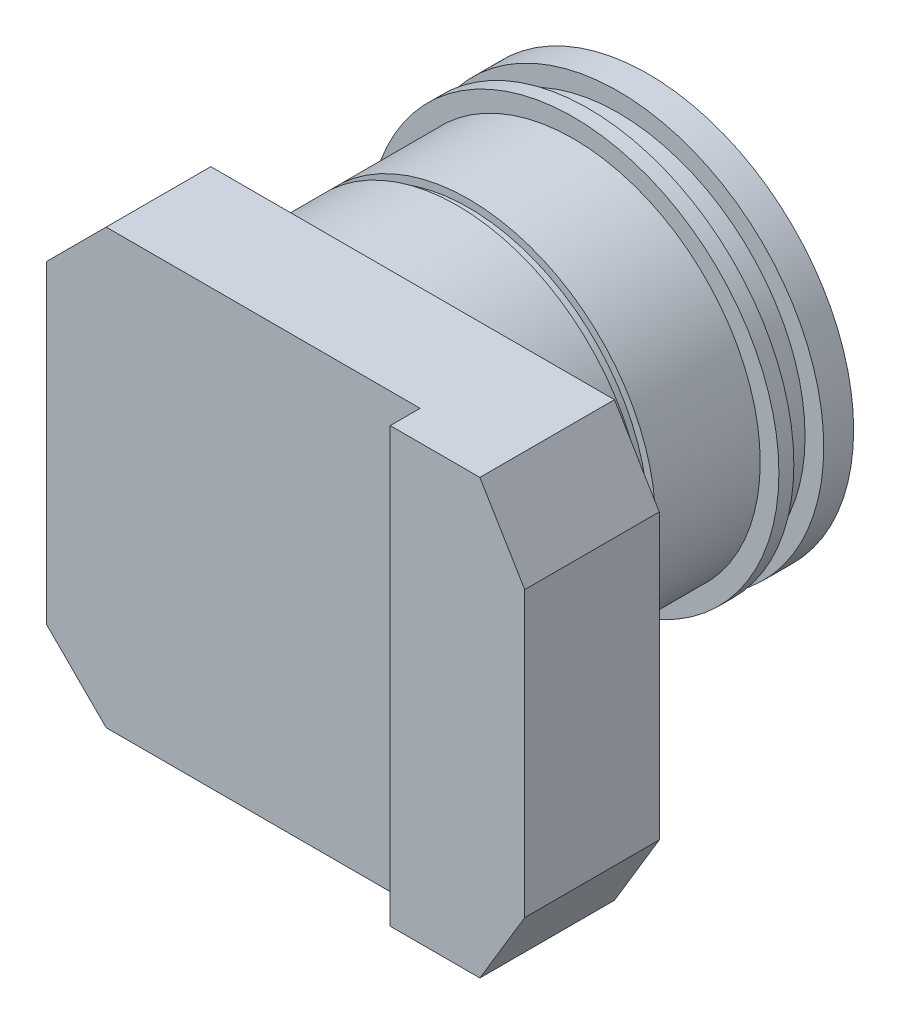
from build123d import *

# Parameters (mm, degrees)
SKETCH1_W           = 34
SKETCH1_H           = 29
BOSS_EXTRUDE1_DEPTH = 3.5
SKETCH2_W           = 9
SKETCH2_H           = 29
BOSS_EXTRUDE2_DEPTH = 2
CUT_EXTRUDE1_DEPTH  = 25.088378941
SKETCH5_R           = 9.75
CUT_EXTRUDE2_DEPTH  = 5
CUT_EXTRUDE2_DRAFT  = -45


with BuildPart() as part:
    # Sketch1 → Boss-Extrude1 (new, symmetric)
    with BuildSketch(Plane.XY):
        Rectangle(SKETCH1_W, SKETCH1_H)
    extrude(amount=BOSS_EXTRUDE1_DEPTH, both=True)

    # Sketch2 → Boss-Extrude2 (add)
    with BuildSketch(Plane.XY.offset(3.5)):
        with Locations((12.5, 0)):
            Rectangle(SKETCH2_W, SKETCH2_H)
    extrude(amount=BOSS_EXTRUDE2_DEPTH)

    # Sketch3 → Cut-Extrude1 (cut, through all)
    with BuildSketch(Plane(origin=(0, 0, -3.5), x_dir=(-1, 0, 0), z_dir=(0, 0, -1))):
        Polygon((-14, -14.5), (-17, -9.5), (-17, -14.5), align=None)
        Polygon((13, -14.5), (17, -10.5), (17, -14.5), align=None)
        Polygon((17, 10.5), (13, 14.5), (17, 14.5), align=None)
        Polygon((-17, 9.5), (-14, 14.5), (-17, 14.5), align=None)
    extrude(amount=-CUT_EXTRUDE1_DEPTH, mode=Mode.SUBTRACT)

    # Sketch4 → Revolve1 (revolve)
    with BuildSketch(Plane(origin=(0, 0, 0), x_dir=(1, 0, 0), z_dir=(0, 1, 0))):
        Polygon((-17, 3.5), (-4.5, 3.5), (-4.5, 24.25), (-18.25, 24.25), (-18.25, 22.25), (-17, 22.25), (-17, 20.25), (-18.25, 20.25), (-18.25, 19.25), (-17, 19.25), (-17, 12.25), (-16.5, 12.25), (-16.5, 11.5), (-17, 11.5), align=None)
    revolve(axis=Axis((-4.5, 0, -3.5), (0, 0, -1)))


with BuildPart() as cut_extrude2_tool:
    # Sketch5 → Cut-Extrude2 (with draft: the straight prism first)
    with BuildSketch(Plane(origin=(0, 0, -24.25), x_dir=(-1, 0, 0), z_dir=(0, 0, -1))):
        with Locations((4.5, 0)):
            Circle(SKETCH5_R)
    extrude(amount=-CUT_EXTRUDE2_DEPTH)
    # Cut-Extrude2: the draft: its side faces are tilted about the plane it starts from
    cut_extrude2_sides = [cut_extrude2_tool.faces().sort_by_distance(p)[0] for p in [
        (5.25, 0, -21.75),
    ]]
    draft(cut_extrude2_sides, Plane(origin=(0, 0, -24.25), x_dir=(-1, 0, 0), z_dir=(0, 0, -1)), CUT_EXTRUDE2_DRAFT)


with BuildPart() as part_1:
    add(part.part)

    # Cut-Extrude2: cut by cut_extrude2_tool
    add(cut_extrude2_tool.part, mode=Mode.SUBTRACT)

    # Sketch6 → Revolve2 (revolve)
    with BuildSketch(Plane(origin=(0, 0, 0), x_dir=(1, 0, 0), z_dir=(0, 1, 0))):
        with BuildLine():
            Line((-9.25, 19.25), (-4.5, 19.25))
            Line((-4.5, 19.25), (-4.5, 24))
            ThreePointArc((-4.5, 24), (-7.858757211, 22.608757211), (-9.25, 19.25))
        make_face()
    revolve(axis=Axis((-4.5, 0, -19.25), (0, 0, -1)))


solid = part_1.part
